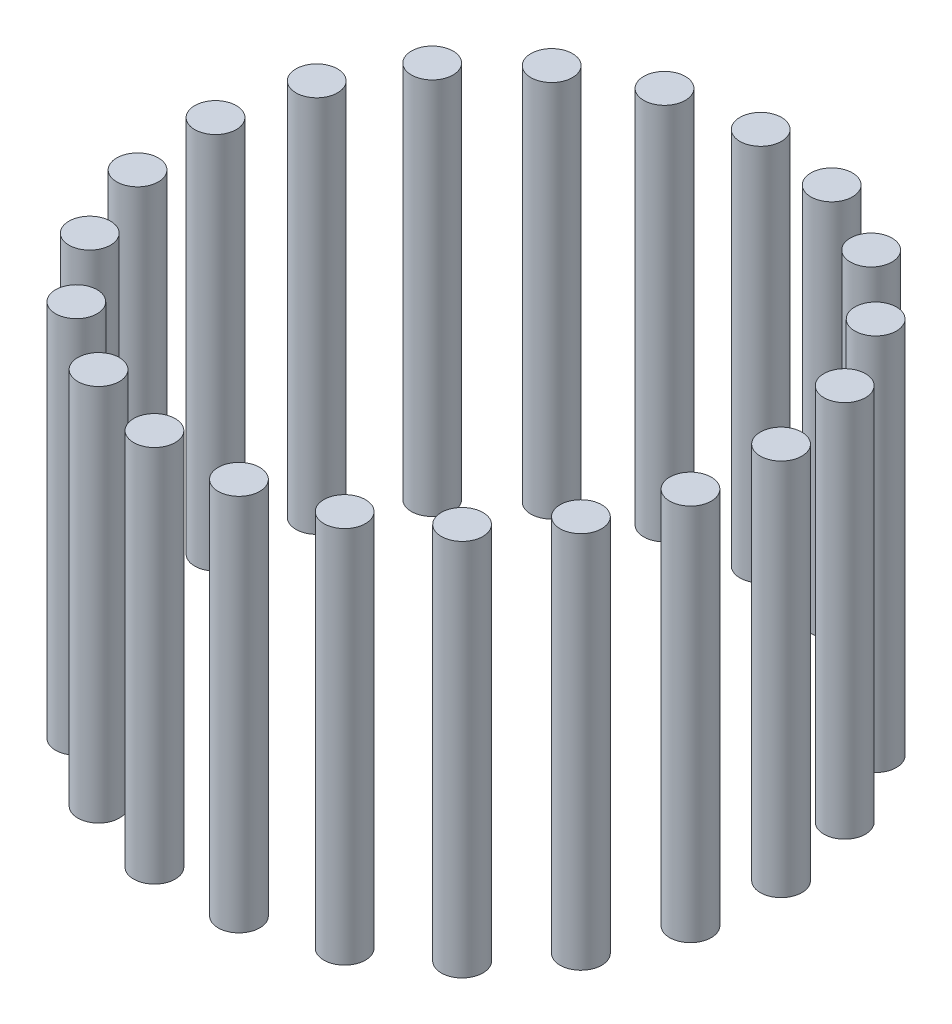
from build123d import *

# Parameters (mm, degrees)
SKETCH1_R              = 5.5
BOSS_EXTRUDE1_DEPTH    = 100
BOSS_EXTRUDE1_2_DEPTH  = 100
BOSS_EXTRUDE1_3_DEPTH  = 100
BOSS_EXTRUDE1_4_DEPTH  = 100
BOSS_EXTRUDE1_5_DEPTH  = 100
BOSS_EXTRUDE1_6_DEPTH  = 100
BOSS_EXTRUDE1_7_DEPTH  = 100
BOSS_EXTRUDE1_8_DEPTH  = 100
BOSS_EXTRUDE1_9_DEPTH  = 100
BOSS_EXTRUDE1_10_DEPTH = 100
BOSS_EXTRUDE1_11_DEPTH = 100
BOSS_EXTRUDE1_12_DEPTH = 100
BOSS_EXTRUDE1_13_DEPTH = 100
BOSS_EXTRUDE1_14_DEPTH = 100
BOSS_EXTRUDE1_15_DEPTH = 100
BOSS_EXTRUDE1_16_DEPTH = 100
BOSS_EXTRUDE1_17_DEPTH = 100
BOSS_EXTRUDE1_18_DEPTH = 100
BOSS_EXTRUDE1_19_DEPTH = 100
BOSS_EXTRUDE1_20_DEPTH = 100
BOSS_EXTRUDE1_21_DEPTH = 100


with BuildPart() as part:
    # Sketch1 → Boss-Extrude1 (new body)
    with BuildSketch(Plane(origin=(0, 0, 0), x_dir=(1, 0, 0), z_dir=(0, 1, 0))):
        with Locations((0, 75)):
            Circle(SKETCH1_R)
    extrude(amount=BOSS_EXTRUDE1_DEPTH)


with BuildPart() as body_2:
    # Sketch1 → Boss-Extrude1 2 (new body)
    with BuildSketch(Plane(origin=(0, 0, 0), x_dir=(1, 0, 0), z_dir=(0, 1, 0))):
        with Locations((22.106638081, 71.667960434)):
            Circle(SKETCH1_R)
    extrude(amount=BOSS_EXTRUDE1_2_DEPTH)


with BuildPart() as body_3:
    # Sketch1 → Boss-Extrude1 3 (new body)
    with BuildSketch(Plane(origin=(0, 0, 0), x_dir=(1, 0, 0), z_dir=(0, 1, 0))):
        with Locations((42.249004355, 61.967908074)):
            Circle(SKETCH1_R)
    extrude(amount=BOSS_EXTRUDE1_3_DEPTH)


with BuildPart() as body_4:
    # Sketch1 → Boss-Extrude1 4 (new body)
    with BuildSketch(Plane(origin=(0, 0, 0), x_dir=(1, 0, 0), z_dir=(0, 1, 0))):
        with Locations((58.637361185, 46.761735139)):
            Circle(SKETCH1_R)
    extrude(amount=BOSS_EXTRUDE1_4_DEPTH)


with BuildPart() as body_5:
    # Sketch1 → Boss-Extrude1 5 (new body)
    with BuildSketch(Plane(origin=(0, 0, 0), x_dir=(1, 0, 0), z_dir=(0, 1, 0))):
        with Locations((69.815531148, 27.400576827)):
            Circle(SKETCH1_R)
    extrude(amount=BOSS_EXTRUDE1_5_DEPTH)


with BuildPart() as body_6:
    # Sketch1 → Boss-Extrude1 6 (new body)
    with BuildSketch(Plane(origin=(0, 0, 0), x_dir=(1, 0, 0), z_dir=(0, 1, 0))):
        with Locations((74.790284789, 5.604757019)):
            Circle(SKETCH1_R)
    extrude(amount=BOSS_EXTRUDE1_6_DEPTH)


with BuildPart() as body_7:
    # Sketch1 → Boss-Extrude1 7 (new body)
    with BuildSketch(Plane(origin=(0, 0, 0), x_dir=(1, 0, 0), z_dir=(0, 1, 0))):
        with Locations((73.119593414, -16.689070047)):
            Circle(SKETCH1_R)
    extrude(amount=BOSS_EXTRUDE1_7_DEPTH)


with BuildPart() as body_8:
    # Sketch1 → Boss-Extrude1 8 (new body)
    with BuildSketch(Plane(origin=(0, 0, 0), x_dir=(1, 0, 0), z_dir=(0, 1, 0))):
        with Locations((64.951905284, -37.5)):
            Circle(SKETCH1_R)
    extrude(amount=BOSS_EXTRUDE1_8_DEPTH)


with BuildPart() as body_9:
    # Sketch1 → Boss-Extrude1 9 (new body)
    with BuildSketch(Plane(origin=(0, 0, 0), x_dir=(1, 0, 0), z_dir=(0, 1, 0))):
        with Locations((51.012955333, -54.978890387)):
            Circle(SKETCH1_R)
    extrude(amount=BOSS_EXTRUDE1_9_DEPTH)


with BuildPart() as body_10:
    # Sketch1 → Boss-Extrude1 10 (new body)
    with BuildSketch(Plane(origin=(0, 0, 0), x_dir=(1, 0, 0), z_dir=(0, 1, 0))):
        with Locations((32.541280434, -67.572665093)):
            Circle(SKETCH1_R)
    extrude(amount=BOSS_EXTRUDE1_10_DEPTH)


with BuildPart() as body_11:
    # Sketch1 → Boss-Extrude1 11 (new body)
    with BuildSketch(Plane(origin=(0, 0, 0), x_dir=(1, 0, 0), z_dir=(0, 1, 0))):
        with Locations((11.178169963, -74.162311967)):
            Circle(SKETCH1_R)
    extrude(amount=BOSS_EXTRUDE1_11_DEPTH)


with BuildPart() as body_12:
    # Sketch1 → Boss-Extrude1 12 (new body)
    with BuildSketch(Plane(origin=(0, 0, 0), x_dir=(1, 0, 0), z_dir=(0, 1, 0))):
        with Locations((-11.178169963, -74.162311967)):
            Circle(SKETCH1_R)
    extrude(amount=BOSS_EXTRUDE1_12_DEPTH)


with BuildPart() as body_13:
    # Sketch1 → Boss-Extrude1 13 (new body)
    with BuildSketch(Plane(origin=(0, 0, 0), x_dir=(1, 0, 0), z_dir=(0, 1, 0))):
        with Locations((-32.541280434, -67.572665093)):
            Circle(SKETCH1_R)
    extrude(amount=BOSS_EXTRUDE1_13_DEPTH)


with BuildPart() as body_14:
    # Sketch1 → Boss-Extrude1 14 (new body)
    with BuildSketch(Plane(origin=(0, 0, 0), x_dir=(1, 0, 0), z_dir=(0, 1, 0))):
        with Locations((-51.012955333, -54.978890387)):
            Circle(SKETCH1_R)
    extrude(amount=BOSS_EXTRUDE1_14_DEPTH)


with BuildPart() as body_15:
    # Sketch1 → Boss-Extrude1 15 (new body)
    with BuildSketch(Plane(origin=(0, 0, 0), x_dir=(1, 0, 0), z_dir=(0, 1, 0))):
        with Locations((-64.951905284, -37.5)):
            Circle(SKETCH1_R)
    extrude(amount=BOSS_EXTRUDE1_15_DEPTH)


with BuildPart() as body_16:
    # Sketch1 → Boss-Extrude1 16 (new body)
    with BuildSketch(Plane(origin=(0, 0, 0), x_dir=(1, 0, 0), z_dir=(0, 1, 0))):
        with Locations((-73.119593414, -16.689070047)):
            Circle(SKETCH1_R)
    extrude(amount=BOSS_EXTRUDE1_16_DEPTH)


with BuildPart() as body_17:
    # Sketch1 → Boss-Extrude1 17 (new body)
    with BuildSketch(Plane(origin=(0, 0, 0), x_dir=(1, 0, 0), z_dir=(0, 1, 0))):
        with Locations((-74.790284789, 5.604757019)):
            Circle(SKETCH1_R)
    extrude(amount=BOSS_EXTRUDE1_17_DEPTH)


with BuildPart() as body_18:
    # Sketch1 → Boss-Extrude1 18 (new body)
    with BuildSketch(Plane(origin=(0, 0, 0), x_dir=(1, 0, 0), z_dir=(0, 1, 0))):
        with Locations((-69.815531148, 27.400576827)):
            Circle(SKETCH1_R)
    extrude(amount=BOSS_EXTRUDE1_18_DEPTH)


with BuildPart() as body_19:
    # Sketch1 → Boss-Extrude1 19 (new body)
    with BuildSketch(Plane(origin=(0, 0, 0), x_dir=(1, 0, 0), z_dir=(0, 1, 0))):
        with Locations((-58.637361185, 46.761735139)):
            Circle(SKETCH1_R)
    extrude(amount=BOSS_EXTRUDE1_19_DEPTH)


with BuildPart() as body_20:
    # Sketch1 → Boss-Extrude1 20 (new body)
    with BuildSketch(Plane(origin=(0, 0, 0), x_dir=(1, 0, 0), z_dir=(0, 1, 0))):
        with Locations((-42.249004355, 61.967908074)):
            Circle(SKETCH1_R)
    extrude(amount=BOSS_EXTRUDE1_20_DEPTH)


with BuildPart() as body_21:
    # Sketch1 → Boss-Extrude1 21 (new body)
    with BuildSketch(Plane(origin=(0, 0, 0), x_dir=(1, 0, 0), z_dir=(0, 1, 0))):
        with Locations((-22.106638081, 71.667960434)):
            Circle(SKETCH1_R)
    extrude(amount=BOSS_EXTRUDE1_21_DEPTH)


solid = Compound([part.part, body_2.part, body_3.part, body_4.part, body_5.part, body_6.part, body_7.part, body_8.part, body_9.part, body_10.part, body_11.part, body_12.part, body_13.part, body_14.part, body_15.part, body_16.part, body_17.part, body_18.part, body_19.part, body_20.part, body_21.part])
